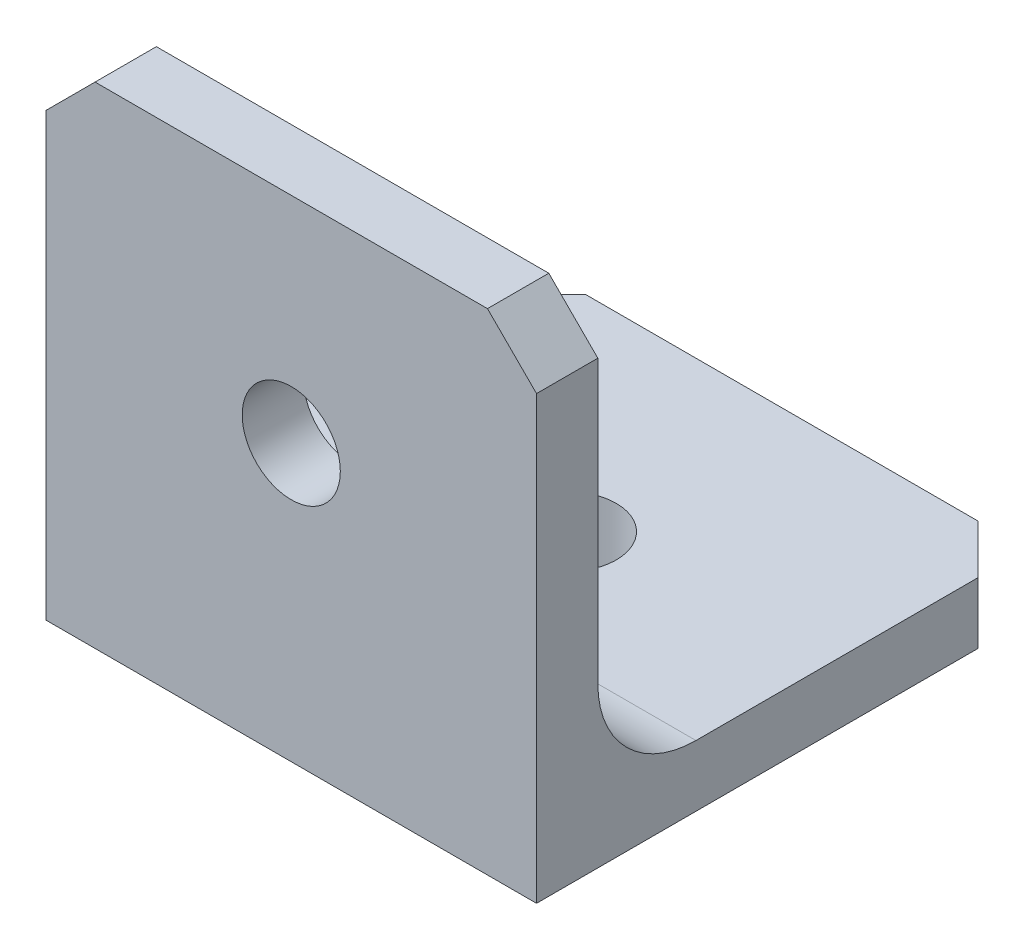
from build123d import *

# Parameters (mm, degrees)
BOSS_EXTRUDE1_DEPTH = 25.4
SKETCH2_R           = 2.54
CUT_EXTRUDE1_DEPTH  = 44.994090512
SKETCH3_R           = 2.54
CUT_EXTRUDE2_DEPTH  = 44.994090512
FILLET1_R           = 5.08
CHAMFER1_SIZE       = 2.54


with BuildPart() as part:
    # Sketch1 → Boss-Extrude1 (new body)
    with BuildSketch(Plane(origin=(0, 0, 0), x_dir=(0, 0, -1), z_dir=(1, 0, 0))):
        Polygon((0, 0), (0, 25.4), (3.175, 25.4), (3.175, 3.175), (25.4, 3.175), (25.4, 0), align=None)
    extrude(amount=BOSS_EXTRUDE1_DEPTH)

    # Sketch2 → Cut-Extrude1 (cut, through all)
    with BuildSketch(Plane.XY):
        with Locations((12.7, 14.2875)):
            Circle(SKETCH2_R)
    extrude(amount=-CUT_EXTRUDE1_DEPTH, mode=Mode.SUBTRACT)

    # Sketch3 → Cut-Extrude2 (cut, through all)
    with BuildSketch(Plane.XZ):
        with Locations((12.7, -14.2875)):
            Circle(SKETCH3_R)
    extrude(amount=-CUT_EXTRUDE2_DEPTH, mode=Mode.SUBTRACT)

    # Fillet1
    fillet1_edges = [part.edges().sort_by_distance(p)[0] for p in [
        (12.7, 3.175, -3.175),
    ]]
    fillet(fillet1_edges, radius=FILLET1_R)

    # Chamfer1
    chamfer1_edges = [part.edges().sort_by_distance(p)[0] for p in [
        (0, 1.5875, -25.4),
        (25.4, 1.5875, -25.4),
        (25.4, 25.4, -1.5875),
        (0, 25.4, -1.5875),
    ]]
    chamfer(chamfer1_edges, length=CHAMFER1_SIZE)


solid = part.part
